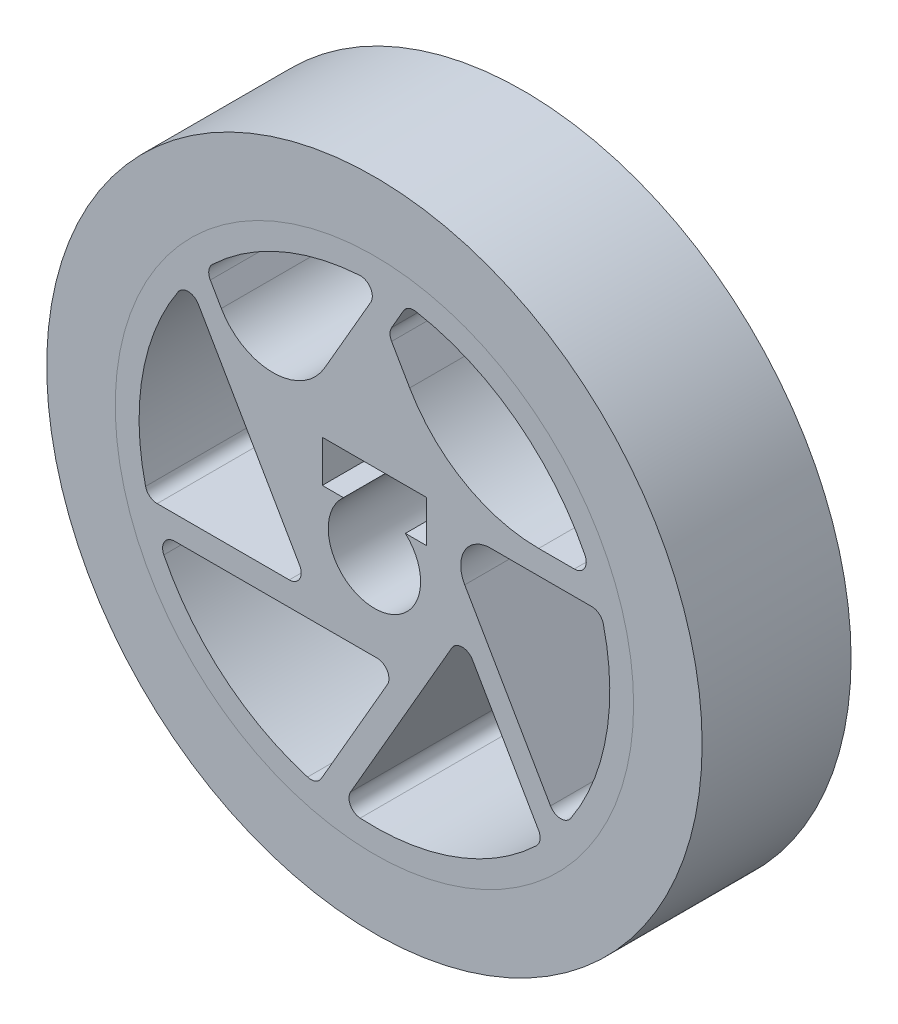
from build123d import *

# Parameters (mm, degrees)
SKETCH1_R              = 17.4
BOSS_EXTRUDE1_DEPTH    = 10
BOSS_EXTRUDE3_DEPTH    = 10
FILLET1_R              = 0.8
FILLET2_R              = 0.8
FILLET3_R              = 0.8
CUT_EXTRUDE1_START     = -10.700000099
CUT_EXTRUDE1_OUTLINE_R = 1.8
CUT_EXTRUDE1_DEPTH     = 10.700000099
CUT_EXTRUDE1_START_2   = -1e-07
CUT_EXTRUDE1_2_DEPTH   = 10.0000002
SKETCH6_R              = 1.4
CUT_EXTRUDE3_DEPTH     = 31.149792736
SKETCH11_R             = 22
SKETCH11_R_2           = 17.4
BOSS_EXTRUDE7_DEPTH    = 10
FILLET4_R              = 10
FILLET5_R              = 4
FILLET6_R              = 2


with BuildPart() as part:
    # Sketch1 → Boss-Extrude1 (new body)
    with BuildSketch(Plane.XY):
        Circle(SKETCH1_R)
        with BuildLine():
            Line((2.078460969, 2.3), (3.5, 2.3))
            Line((3.5, 2.3), (3.5, 5.1))
            Line((3.5, 5.1), (-3.5, 5.1))
            Line((-3.5, 5.1), (-3.5, 2.3))
            Line((-3.5, 2.3), (-2.078460969, 2.3))
            ThreePointArc((-2.078460969, 2.3), (0, -3.1), (2.078460969, 2.3))
        make_face(mode=Mode.SUBTRACT)
        with BuildLine():
            Line((-6.812733176, 0), (-12.438089983, 9.743403799))
            ThreePointArc((-12.438089983, 9.743403799), (-15.502267656, 3.052817964), (-15.20361799, -4.3))
            Line((-15.20361799, -4.3), (-4.330127019, -4.3))
            Line((-4.330127019, -4.3), (-6.812733176, 0))
        make_face(mode=Mode.SUBTRACT)
        with BuildLine():
            Line((-3.406366588, -5.9), (-14.6570802, -5.9))
            ThreePointArc((-14.6570802, -5.9), (-10.394951738, -11.898948625), (-3.877899759, -15.316719409))
            Line((-3.877899759, -15.316719409), (1.558845727, -5.9))
            Line((1.558845727, -5.9), (-3.406366588, -5.9))
        make_face(mode=Mode.SUBTRACT)
        with BuildLine():
            Line((3.406366588, -5.9), (-2.218990218, -15.643403799))
            ThreePointArc((-2.218990218, -15.643403799), (5.107315918, -14.951766588), (11.325718232, -11.016719409))
            Line((11.325718232, -11.016719409), (5.888972746, -1.6))
            Line((5.888972746, -1.6), (3.406366588, -5.9))
        make_face(mode=Mode.SUBTRACT)
        with BuildLine():
            Line((6.812733176, 0), (12.438089983, -9.743403799))
            ThreePointArc((12.438089983, -9.743403799), (15.502267656, -3.052817964), (15.20361799, 4.3))
            Line((15.20361799, 4.3), (4.330127019, 4.3))
            Line((4.330127019, 4.3), (6.812733176, 0))
        make_face(mode=Mode.SUBTRACT)
        with BuildLine():
            Line((-11.325718232, 11.016719409), (-6.812733176, 3.2))
            Line((-6.812733176, 3.2), (-3.345858956, 9.204802293))
            Line((-3.345858956, 9.204802293), (0.458046128, 15.793359166))
            ThreePointArc((0.458046128, 15.793359166), (-5.935540926, 14.642723583), (-11.325718232, 11.016719409))
        make_face(mode=Mode.SUBTRACT)
        with BuildLine():
            Line((3.345858956, 9.204802293), (5.25388745, 5.9))
            Line((5.25388745, 5.9), (14.6570802, 5.9))
            ThreePointArc((14.6570802, 5.9), (9.743403799, 12.438089983), (2.218990218, 15.643403799))
            Line((2.218990218, 15.643403799), (-1.498338095, 9.204802293))
            Line((-1.498338095, 9.204802293), (3.345858956, 9.204802293))
        make_face(mode=Mode.SUBTRACT)
    extrude(amount=BOSS_EXTRUDE1_DEPTH)

    # Sketch9 → Boss-Extrude3 (add)
    with BuildSketch(Plane(origin=(0, 0, 0), x_dir=(-1, 0, 0), z_dir=(0, 0, -1))):
        Polygon((-3.345858956, 9.204802293), (-0.923760431, 13.4), (1.498338095, 9.204802293), align=None)
    extrude(amount=-BOSS_EXTRUDE3_DEPTH)

    # Fillet1
    fillet1_edges = [part.edges().sort_by_distance(p)[0] for p in [
        (0.923760431, 13.4, 5),
        (5.888972746, -1.6, 5),
        (-4.330127019, -4.3, 5),
        (1.558845727, -5.9, 5),
    ]]
    fillet(fillet1_edges, radius=FILLET1_R)

    # Fillet2
    fillet2_edges = [part.edges().sort_by_distance(p)[0] for p in [
        (-2.218990218, -15.643403799, 5),
        (12.438089983, -9.743403799, 5),
        (-12.438089983, 9.743403799, 5),
        (-14.6570802, -5.9, 5),
        (0.458046128, 15.793359166, 5),
        (14.6570802, 5.9, 5),
    ]]
    fillet(fillet2_edges, radius=FILLET2_R)

    # Fillet3
    fillet3_edges = [part.edges().sort_by_distance(p)[0] for p in [
        (11.325718232, -11.016719409, 5),
        (15.20361799, 4.3, 5),
        (-15.20361799, -4.3, 5),
        (-3.877899759, -15.316719409, 5),
        (-11.325718232, 11.016719409, 5),
        (2.218990218, 15.643403799, 5),
    ]]
    fillet(fillet3_edges, radius=FILLET3_R)

    # Cut-Extrude1: read off the stored shape, not the designer's step
    # Cut-Extrude1 outline → Cut-Extrude1 (cut)
    with BuildSketch(Plane.XZ.offset(-5.1).offset(CUT_EXTRUDE1_START)):
        with Locations((0, 5)):
            Circle(CUT_EXTRUDE1_OUTLINE_R)
    extrude(amount=CUT_EXTRUDE1_DEPTH, mode=Mode.SUBTRACT)

    # Cut-Extrude1 2 outline → Cut-Extrude1 2 (add)
    with BuildSketch(Plane.XY.offset(CUT_EXTRUDE1_START_2)):
        with BuildLine():
            Line((-3, 15.800000099), (-3, 15.512575543))
            ThreePointArc((-3, 15.512575543), (-1.506868675, 15.727979743), (0, 15.8))
            Line((0, 15.8), (-3, 15.800000099))
        make_face()
        with BuildLine():
            Line((3, 15.800000099), (0, 15.8))
            ThreePointArc((0, 15.8), (0.901468663, 15.774262399), (1.80000041, 15.697133449))
            Line((1.80000041, 15.697133449), (3, 15.559528723))
            Line((3, 15.559528723), (3, 15.800000099))
        make_face()
    extrude(amount=CUT_EXTRUDE1_2_DEPTH)

    # Sketch6 → Cut-Extrude3 (cut, through all)
    with BuildSketch(Plane.XZ.offset(-5.1)):
        with Locations((0, 5)):
            Circle(SKETCH6_R)
    extrude(amount=-CUT_EXTRUDE3_DEPTH, mode=Mode.SUBTRACT)

    # Fillet4
    fillet4_edges = [part.edges().sort_by_distance(p)[0] for p in [
        (5.25388745, 5.9, 5),
    ]]
    fillet(fillet4_edges, radius=FILLET4_R)

    # Fillet5
    fillet5_edges = [part.edges().sort_by_distance(p)[0] for p in [
        (-6.812733176, 3.2, 5),
    ]]
    fillet(fillet5_edges, radius=FILLET5_R)

    # Fillet6
    fillet6_edges = [part.edges().sort_by_distance(p)[0] for p in [
        (4.330127019, 4.3, 5),
    ]]
    fillet(fillet6_edges, radius=FILLET6_R)


with BuildPart() as body_2:
    # Sketch11 → Boss-Extrude7 (new body)
    with BuildSketch(Plane.XY.offset(10)):
        Circle(SKETCH11_R)
        Circle(SKETCH11_R_2, mode=Mode.SUBTRACT)
    extrude(amount=-BOSS_EXTRUDE7_DEPTH)


solid = Compound([part.part, body_2.part])
